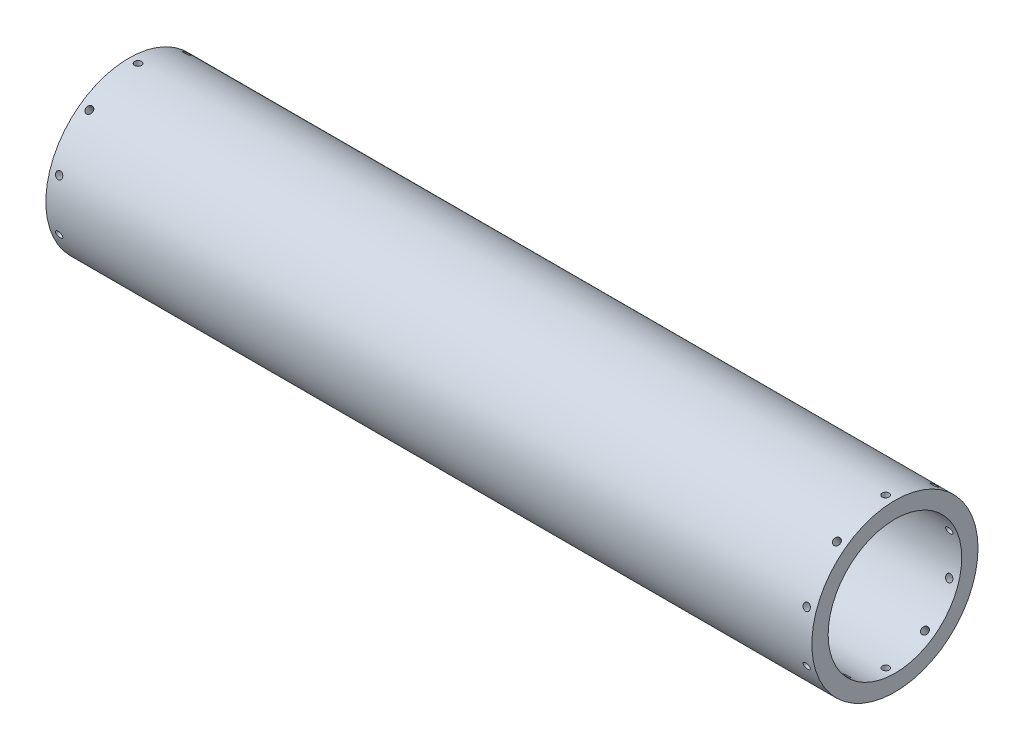
from build123d import *

# Parameters (mm, degrees)
SKETCH1_R           = 57.15
SKETCH1_R_2         = 45.9486
BOSS_EXTRUDE1_DEPTH = 527.05
SKETCH2_R           = 45.9486
SKETCH2_R_2         = 44.577
BOSS_EXTRUDE2_DEPTH = 88.9
SKETCH6_R           = 2.413
CUT_EXTRUDE1_DEPTH  = 15.24
CIRPATTERN1_COUNT   = 10
SKETCH7_R           = 2.413
CUT_EXTRUDE2_DEPTH  = 15.24
CIRPATTERN2_COUNT   = 10


with BuildPart() as part:
    # Sketch1 → Boss-Extrude1 (new body)
    with BuildSketch(Plane(origin=(0, 0, 0), x_dir=(0, 0, -1), z_dir=(1, 0, 0))):
        Circle(SKETCH1_R)
        Circle(SKETCH1_R_2, mode=Mode.SUBTRACT)
    extrude(amount=BOSS_EXTRUDE1_DEPTH)

    # Sketch2 → Boss-Extrude2 (add)
    with BuildSketch(Plane.ZY):
        Circle(SKETCH2_R)
        Circle(SKETCH2_R_2, mode=Mode.SUBTRACT)
    extrude(amount=-BOSS_EXTRUDE2_DEPTH)

    # Sketch6 → Cut-Extrude1 (cut)
    with BuildSketch(Plane(origin=(0, 57.15, 0), x_dir=(1, 0, 0), z_dir=(0, 1, 0))):
        with Locations((6.35, 0)):
            Circle(SKETCH6_R)
    cut_extrude1 = extrude(amount=-CUT_EXTRUDE1_DEPTH, mode=Mode.SUBTRACT)

    # CirPattern1: Cut-Extrude1 ×10 about axis
    cirpattern1_axis = Axis((0, 0, 0), (-1, 0, 0))
    for i in range(1, CIRPATTERN1_COUNT):
        add(cut_extrude1.rotate(cirpattern1_axis, i * 360 / CIRPATTERN1_COUNT), mode=Mode.SUBTRACT)

    # Sketch7 → Cut-Extrude2 (cut)
    with BuildSketch(Plane(origin=(0, 57.15, 0), x_dir=(1, 0, 0), z_dir=(0, 1, 0))):
        with Locations((520.7, 0)):
            Circle(SKETCH7_R)
    cut_extrude2 = extrude(amount=-CUT_EXTRUDE2_DEPTH, mode=Mode.SUBTRACT)

    # CirPattern2: Cut-Extrude2 ×10 about axis
    cirpattern2_axis = Axis((527.05, 0, 0), (1, 0, 0))
    for i in range(1, CIRPATTERN2_COUNT):
        add(cut_extrude2.rotate(cirpattern2_axis, i * 360 / CIRPATTERN2_COUNT), mode=Mode.SUBTRACT)


solid = part.part
